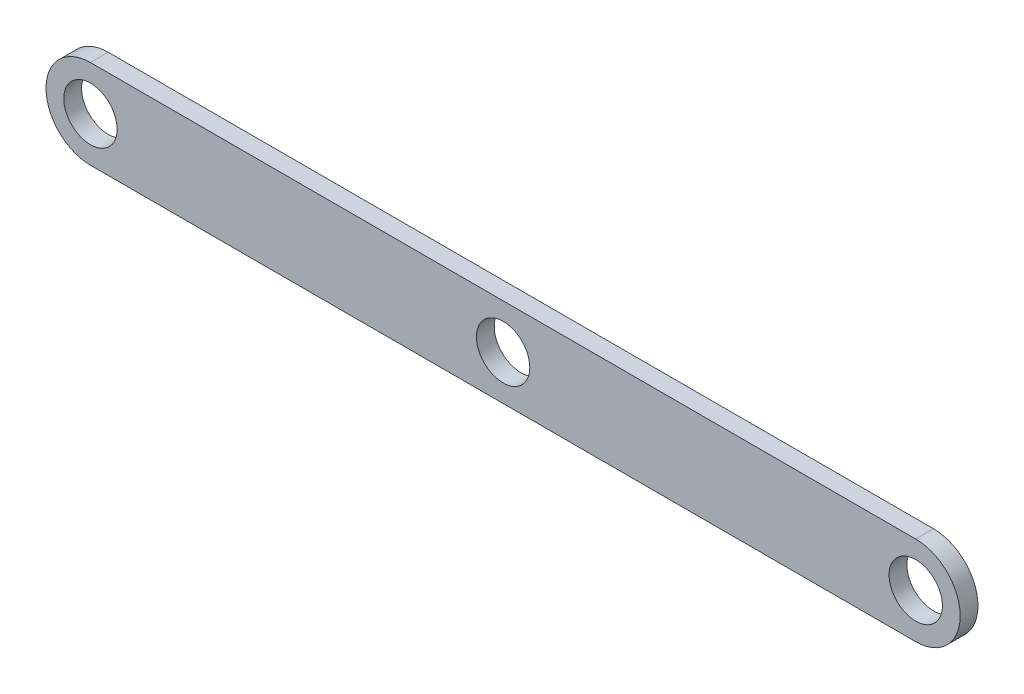
from build123d import *

# Parameters (mm, degrees)
SKETCH1_R           = 4.7625
BOSS_EXTRUDE1_DEPTH = 3.175


with BuildPart() as part:
    # Sketch1 → Boss-Extrude1 (new body)
    with BuildSketch(Plane.XY):
        with BuildLine():
            Line((-73.66, 7.9375), (73.66, 7.9375))
            ThreePointArc((73.66, 7.9375), (81.5975, 0), (73.66, -7.9375))
            Line((73.66, -7.9375), (-73.66, -7.9375))
            ThreePointArc((-73.66, -7.9375), (-81.5975, 0), (-73.66, 7.9375))
        make_face()
        with Locations((73.66, 0)):
            Circle(SKETCH1_R, mode=Mode.SUBTRACT)
        with Locations((-73.66, 0)):
            Circle(SKETCH1_R, mode=Mode.SUBTRACT)
        Circle(SKETCH1_R, mode=Mode.SUBTRACT)
    extrude(amount=BOSS_EXTRUDE1_DEPTH)


solid = part.part
